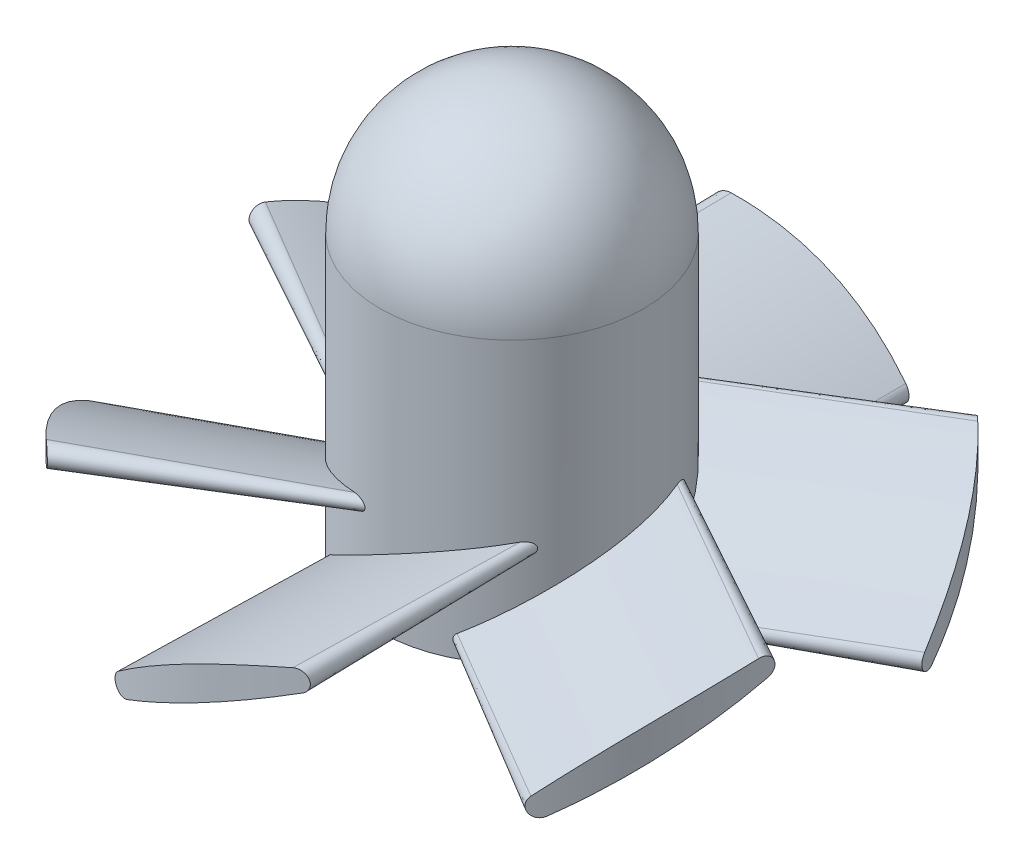
from build123d import *

# Parameters (mm, degrees)
BOSS_EXTRU_1_DEPTH                  = 30
BOSS_EXTRU_1_DRAFT                  = -1
R_P_TITION_CIRCULAIRE1_COPY_1_DEPTH = 30
R_P_TITION_CIRCULAIRE1_COPY_1_DRAFT = -1
R_P_TITION_CIRCULAIRE1_COPY_2_DEPTH = 30
R_P_TITION_CIRCULAIRE1_COPY_2_DRAFT = -1
R_P_TITION_CIRCULAIRE1_COPY_3_DEPTH = 30
R_P_TITION_CIRCULAIRE1_COPY_3_DRAFT = -1
R_P_TITION_CIRCULAIRE1_COPY_4_DEPTH = 30
R_P_TITION_CIRCULAIRE1_COPY_4_DRAFT = -1
R_P_TITION_CIRCULAIRE1_COPY_5_DEPTH = 30
R_P_TITION_CIRCULAIRE1_COPY_5_DRAFT = -1
ESQUISSE3_OUTSIDE_W                 = 78.314
ESQUISSE3_OUTSIDE_H                 = 79.528
ESQUISSE3_OUTSIDE_R                 = 20
ENL_V_MAT_EXTRU_1_DEPTH             = 49.876622698


with BuildPart() as part:
    # Esquisse1 → Révolution1 (revolve)
    with BuildSketch(Plane.XY):
        with BuildLine():
            Line((0, 0), (8, 0))
            Line((8, 0), (8, 17))
            ThreePointArc((8, 17), (5.656854249, 22.656854249), (0, 25))
            Line((0, 25), (0, 0))
        make_face()
    revolve(axis=Axis((0, 34.994921403, 0), (0, -1, 0)))


with BuildPart() as boss_extru_1_tool:
    # Esquisse2 → Boss.-Extru.1 (with draft: the straight prism first)
    with BuildSketch(Plane.XY):
        with BuildLine():
            Line((-3.865835921, 0.731671843), (6.134164079, 5.731671843))
            ThreePointArc((6.134164079, 5.731671843), (6.279809548, 6.108197119), (5.918738932, 6.288784762))
            ThreePointArc((5.918738932, 6.288784762), (0.62843786, 4.243124279), (-4.182271169, 1.238279712))
            ThreePointArc((-4.182271169, 1.238279712), (-4.254443424, 0.841070633), (-3.865835921, 0.731671843))
        make_face()
    extrude(amount=BOSS_EXTRU_1_DEPTH)
    # Boss.-Extru.1: the draft: its side faces are tilted about the plane it starts from
    boss_extru_1_sides = [boss_extru_1_tool.faces().sort_by_distance(p)[0] for p in [
        (-4.254443424, 0.841070633, 15),
        (1.134164079, 3.231671843, 15),
        (6.279809548, 6.108197119, 15),
        (0.62843786, 4.243124279, 15),
    ]]
    draft(boss_extru_1_sides, Plane.XY, BOSS_EXTRU_1_DRAFT)


with BuildPart() as part_1:
    add(part.part)

    # Boss.-Extru.1: add boss_extru_1_tool
    add(boss_extru_1_tool.part)


with BuildPart() as r_p_tition_circulaire1_copy_1_tool:
    # Répétition circulaire1 copy 1 sketch → Répétition circulaire1 copy 1 (with draft: the straight prism first)
    with BuildSketch(Plane(origin=(0, 0, 0), x_dir=(0.5000000000000001, 0, 0.8660254037844386), z_dir=(-0.8660254037844386, 0, 0.5000000000000001))):
        with BuildLine():
            Line((-3.865835921, 0.731671843), (6.134164079, 5.731671843))
            ThreePointArc((6.134164079, 5.731671843), (6.279809548, 6.108197119), (5.918738932, 6.288784762))
            ThreePointArc((5.918738932, 6.288784762), (0.62843786, 4.243124279), (-4.182271169, 1.238279712))
            ThreePointArc((-4.182271169, 1.238279712), (-4.254443424, 0.841070633), (-3.865835921, 0.731671843))
        make_face()
    extrude(amount=R_P_TITION_CIRCULAIRE1_COPY_1_DEPTH)
    # Répétition circulaire1 copy 1: the draft: its side faces are tilted about the plane it starts from
    r_p_tition_circulaire1_copy_1_sides = [r_p_tition_circulaire1_copy_1_tool.faces().sort_by_distance(p)[0] for p in [
        (-15.117602769, 0.841070633, 3.815543916),
        (-12.423299017, 3.231671843, 8.482214904),
        (-9.850476283, 6.108197119, 12.938474599),
        (-12.676162127, 4.243124279, 8.044243151),
    ]]
    draft(r_p_tition_circulaire1_copy_1_sides, Plane(origin=(0, 0, 0), x_dir=(0.5000000000000001, 0, 0.8660254037844386), z_dir=(-0.8660254037844386, 0, 0.5000000000000001)), R_P_TITION_CIRCULAIRE1_COPY_1_DRAFT)


with BuildPart() as part_2:
    add(part_1.part)

    # Répétition circulaire1 copy 1: add r_p_tition_circulaire1_copy_1_tool
    add(r_p_tition_circulaire1_copy_1_tool.part)


with BuildPart() as r_p_tition_circulaire1_copy_2_tool:
    # Répétition circulaire1 copy 2 sketch → Répétition circulaire1 copy 2 (with draft: the straight prism first)
    with BuildSketch(Plane(origin=(0, 0, 0), x_dir=(-0.4999999999999998, 0, 0.8660254037844387), z_dir=(-0.8660254037844387, 0, -0.4999999999999998))):
        with BuildLine():
            Line((-3.865835921, 0.731671843), (6.134164079, 5.731671843))
            ThreePointArc((6.134164079, 5.731671843), (6.279809548, 6.108197119), (5.918738932, 6.288784762))
            ThreePointArc((5.918738932, 6.288784762), (0.62843786, 4.243124279), (-4.182271169, 1.238279712))
            ThreePointArc((-4.182271169, 1.238279712), (-4.254443424, 0.841070633), (-3.865835921, 0.731671843))
        make_face()
    extrude(amount=R_P_TITION_CIRCULAIRE1_COPY_2_DEPTH)
    # Répétition circulaire1 copy 2: the draft: its side faces are tilted about the plane it starts from
    r_p_tition_circulaire1_copy_2_sides = [r_p_tition_circulaire1_copy_2_tool.faces().sort_by_distance(p)[0] for p in [
        (-10.863159345, 0.841070633, -11.184456084),
        (-13.557463096, 3.231671843, -6.517785096),
        (-16.130285831, 6.108197119, -2.061525401),
        (-13.304599987, 4.243124279, -6.955756849),
    ]]
    draft(r_p_tition_circulaire1_copy_2_sides, Plane(origin=(0, 0, 0), x_dir=(-0.4999999999999998, 0, 0.8660254037844387), z_dir=(-0.8660254037844387, 0, -0.4999999999999998)), R_P_TITION_CIRCULAIRE1_COPY_2_DRAFT)


with BuildPart() as part_3:
    add(part_2.part)

    # Répétition circulaire1 copy 2: add r_p_tition_circulaire1_copy_2_tool
    add(r_p_tition_circulaire1_copy_2_tool.part)


with BuildPart() as r_p_tition_circulaire1_copy_3_tool:
    # Répétition circulaire1 copy 3 sketch → Répétition circulaire1 copy 3 (with draft: the straight prism first)
    with BuildSketch(Plane(origin=(0, 0, 0), x_dir=(-1, 0, 0), z_dir=(0, 0, -1))):
        with BuildLine():
            Line((-3.865835921, 0.731671843), (6.134164079, 5.731671843))
            ThreePointArc((6.134164079, 5.731671843), (6.279809548, 6.108197119), (5.918738932, 6.288784762))
            ThreePointArc((5.918738932, 6.288784762), (0.62843786, 4.243124279), (-4.182271169, 1.238279712))
            ThreePointArc((-4.182271169, 1.238279712), (-4.254443424, 0.841070633), (-3.865835921, 0.731671843))
        make_face()
    extrude(amount=R_P_TITION_CIRCULAIRE1_COPY_3_DEPTH)
    # Répétition circulaire1 copy 3: the draft: its side faces are tilted about the plane it starts from
    r_p_tition_circulaire1_copy_3_sides = [r_p_tition_circulaire1_copy_3_tool.faces().sort_by_distance(p)[0] for p in [
        (4.254443424, 0.841070633, -15),
        (-1.134164079, 3.231671843, -15),
        (-6.279809548, 6.108197119, -15),
        (-0.62843786, 4.243124279, -15),
    ]]
    draft(r_p_tition_circulaire1_copy_3_sides, Plane(origin=(0, 0, 0), x_dir=(-1, 0, 0), z_dir=(0, 0, -1)), R_P_TITION_CIRCULAIRE1_COPY_3_DRAFT)


with BuildPart() as part_4:
    add(part_3.part)

    # Répétition circulaire1 copy 3: add r_p_tition_circulaire1_copy_3_tool
    add(r_p_tition_circulaire1_copy_3_tool.part)


with BuildPart() as r_p_tition_circulaire1_copy_4_tool:
    # Répétition circulaire1 copy 4 sketch → Répétition circulaire1 copy 4 (with draft: the straight prism first)
    with BuildSketch(Plane(origin=(0, 0, 0), x_dir=(-0.5000000000000004, 0, -0.8660254037844384), z_dir=(0.8660254037844384, 0, -0.5000000000000004))):
        with BuildLine():
            Line((-3.865835921, 0.731671843), (6.134164079, 5.731671843))
            ThreePointArc((6.134164079, 5.731671843), (6.279809548, 6.108197119), (5.918738932, 6.288784762))
            ThreePointArc((5.918738932, 6.288784762), (0.62843786, 4.243124279), (-4.182271169, 1.238279712))
            ThreePointArc((-4.182271169, 1.238279712), (-4.254443424, 0.841070633), (-3.865835921, 0.731671843))
        make_face()
    extrude(amount=R_P_TITION_CIRCULAIRE1_COPY_4_DEPTH)
    # Répétition circulaire1 copy 4: the draft: its side faces are tilted about the plane it starts from
    r_p_tition_circulaire1_copy_4_sides = [r_p_tition_circulaire1_copy_4_tool.faces().sort_by_distance(p)[0] for p in [
        (15.117602769, 0.841070633, -3.815543916),
        (12.423299017, 3.231671843, -8.482214904),
        (9.850476283, 6.108197119, -12.938474599),
        (12.676162127, 4.243124279, -8.044243151),
    ]]
    draft(r_p_tition_circulaire1_copy_4_sides, Plane(origin=(0, 0, 0), x_dir=(-0.5000000000000004, 0, -0.8660254037844384), z_dir=(0.8660254037844384, 0, -0.5000000000000004)), R_P_TITION_CIRCULAIRE1_COPY_4_DRAFT)


with BuildPart() as part_5:
    add(part_4.part)

    # Répétition circulaire1 copy 4: add r_p_tition_circulaire1_copy_4_tool
    add(r_p_tition_circulaire1_copy_4_tool.part)


with BuildPart() as r_p_tition_circulaire1_copy_5_tool:
    # Répétition circulaire1 copy 5 sketch → Répétition circulaire1 copy 5 (with draft: the straight prism first)
    with BuildSketch(Plane(origin=(0, 0, 0), x_dir=(0.5000000000000001, 0, -0.8660254037844386), z_dir=(0.8660254037844386, 0, 0.5000000000000001))):
        with BuildLine():
            Line((-3.865835921, 0.731671843), (6.134164079, 5.731671843))
            ThreePointArc((6.134164079, 5.731671843), (6.279809548, 6.108197119), (5.918738932, 6.288784762))
            ThreePointArc((5.918738932, 6.288784762), (0.62843786, 4.243124279), (-4.182271169, 1.238279712))
            ThreePointArc((-4.182271169, 1.238279712), (-4.254443424, 0.841070633), (-3.865835921, 0.731671843))
        make_face()
    extrude(amount=R_P_TITION_CIRCULAIRE1_COPY_5_DEPTH)
    # Répétition circulaire1 copy 5: the draft: its side faces are tilted about the plane it starts from
    r_p_tition_circulaire1_copy_5_sides = [r_p_tition_circulaire1_copy_5_tool.faces().sort_by_distance(p)[0] for p in [
        (10.863159345, 0.841070633, 11.184456084),
        (13.557463096, 3.231671843, 6.517785096),
        (16.130285831, 6.108197119, 2.061525401),
        (13.304599987, 4.243124279, 6.955756849),
    ]]
    draft(r_p_tition_circulaire1_copy_5_sides, Plane(origin=(0, 0, 0), x_dir=(0.5000000000000001, 0, -0.8660254037844386), z_dir=(0.8660254037844386, 0, 0.5000000000000001)), R_P_TITION_CIRCULAIRE1_COPY_5_DRAFT)


with BuildPart() as part_6:
    add(part_5.part)

    # Répétition circulaire1 copy 5: add r_p_tition_circulaire1_copy_5_tool
    add(r_p_tition_circulaire1_copy_5_tool.part)

    # Esquisse3 outside → Enlèv. mat.-Extru.1 (cut, through all)
    with BuildSketch(Plane(origin=(0, 0, 0), x_dir=(1, 0, 0), z_dir=(0, 1, 0))):
        Rectangle(ESQUISSE3_OUTSIDE_W, ESQUISSE3_OUTSIDE_H)
        Circle(ESQUISSE3_OUTSIDE_R, mode=Mode.SUBTRACT)
    extrude(amount=ENL_V_MAT_EXTRU_1_DEPTH, mode=Mode.SUBTRACT)


solid = part_6.part
